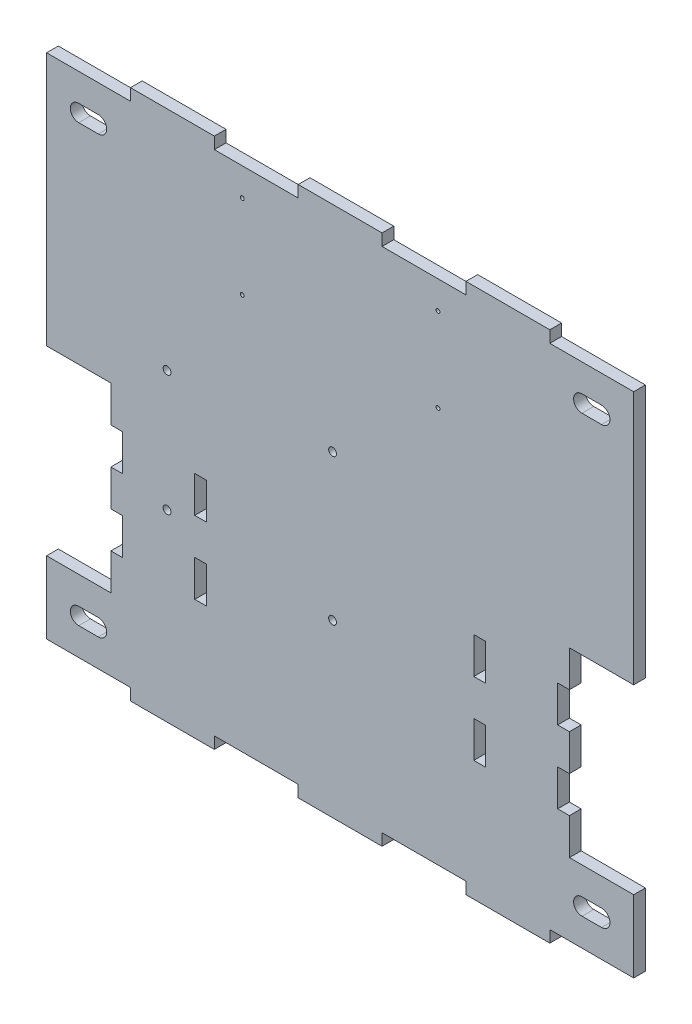
from build123d import *

# Parameters (mm, degrees)
SKETCH1_W           = 266.7
SKETCH1_H           = 241.3
BOSS_EXTRUDE1_DEPTH = 5.334
SKETCH2_W           = 29.21
SKETCH2_H           = 82.55
CUT_EXTRUDE1_DEPTH  = 180.908578328
SKETCH9_W           = 5.334
SKETCH9_H           = 16.51
CUT_EXTRUDE2_DEPTH  = 180.908578328
SKETCH23_W          = 5.334
SKETCH23_H          = 16.51
CUT_EXTRUDE8_DEPTH  = 180.908578328
SKETCH28_W          = 38.1
SKETCH28_H          = 5.334
CUT_EXTRUDE13_DEPTH = 180.908578328
SKETCH29_W          = 38.1
SKETCH29_H          = 5.334
CUT_EXTRUDE14_DEPTH = 180.908578328
SKETCH30_R          = 0.889
CUT_EXTRUDE15_DEPTH = 180.908578328
SKETCH32_R          = 1.778
CUT_EXTRUDE16_DEPTH = 180.908578328
CUT_EXTRUDE19_DEPTH = 180.908578328


with BuildPart() as part:
    # Sketch1 → Boss-Extrude1 (new body)
    with BuildSketch(Plane.XY):
        Rectangle(SKETCH1_W, SKETCH1_H)
    extrude(amount=BOSS_EXTRUDE1_DEPTH)

    # Sketch2 → Cut-Extrude1 (cut, through all)
    with BuildSketch(Plane(origin=(0, 0, 0), x_dir=(-1, 0, 0), z_dir=(0, 0, -1))):
        with Locations((118.745, -41.275)):
            Rectangle(SKETCH2_W, SKETCH2_H)
        with Locations((-118.745, -41.275)):
            Rectangle(SKETCH2_W, SKETCH2_H)
    extrude(amount=-CUT_EXTRUDE1_DEPTH, mode=Mode.SUBTRACT)

    # Sketch9 → Cut-Extrude2 (cut, through all)
    with BuildSketch(Plane.XY.offset(5.334)):
        with Locations((-101.473, -24.765)):
            Rectangle(SKETCH9_W, SKETCH9_H)
        with Locations((-101.473, -57.785)):
            Rectangle(SKETCH9_W, SKETCH9_H)
        with Locations((101.473, -57.785)):
            Rectangle(SKETCH9_W, SKETCH9_H)
        with Locations((101.473, -24.765)):
            Rectangle(SKETCH9_W, SKETCH9_H)
    extrude(amount=-CUT_EXTRUDE2_DEPTH, mode=Mode.SUBTRACT)

    # Sketch23 → Cut-Extrude8 (cut, through all)
    with BuildSketch(Plane.XY.offset(5.334)):
        with Locations((-63.373, -57.785)):
            Rectangle(SKETCH23_W, SKETCH23_H)
        with Locations((63.373, -24.765)):
            Rectangle(SKETCH23_W, SKETCH23_H)
        with Locations((63.373, -57.785)):
            Rectangle(SKETCH23_W, SKETCH23_H)
        with Locations((-63.373, -24.765)):
            Rectangle(SKETCH23_W, SKETCH23_H)
    extrude(amount=-CUT_EXTRUDE8_DEPTH, mode=Mode.SUBTRACT)

    # Sketch28 → Cut-Extrude13 (cut, through all)
    with BuildSketch(Plane(origin=(0, 0, 0), x_dir=(-1, 0, 0), z_dir=(0, 0, -1))):
        with Locations((-114.3, -117.983)):
            Rectangle(SKETCH28_W, SKETCH28_H)
        with Locations((-38.1, -117.983)):
            Rectangle(SKETCH28_W, SKETCH28_H)
        with Locations((38.1, -117.983)):
            Rectangle(SKETCH28_W, SKETCH28_H)
        with Locations((114.3, -117.983)):
            Rectangle(SKETCH28_W, SKETCH28_H)
    extrude(amount=-CUT_EXTRUDE13_DEPTH, mode=Mode.SUBTRACT)

    # Sketch29 → Cut-Extrude14 (cut, through all)
    with BuildSketch(Plane(origin=(0, 0, 0), x_dir=(-1, 0, 0), z_dir=(0, 0, -1))):
        with Locations((-114.3, 117.983)):
            Rectangle(SKETCH29_W, SKETCH29_H)
        with Locations((-38.1, 117.983)):
            Rectangle(SKETCH29_W, SKETCH29_H)
        with Locations((38.1, 117.983)):
            Rectangle(SKETCH29_W, SKETCH29_H)
        with Locations((114.3, 117.983)):
            Rectangle(SKETCH29_W, SKETCH29_H)
    extrude(amount=-CUT_EXTRUDE14_DEPTH, mode=Mode.SUBTRACT)

    # Sketch30 → Cut-Extrude15 (cut, through all)
    with BuildSketch(Plane.XY.offset(5.334)):
        with Locations((-44.45, 102.616)):
            Circle(SKETCH30_R)
        with Locations((44.45, 102.616)):
            Circle(SKETCH30_R)
        with Locations((-44.45, 64.516)):
            Circle(SKETCH30_R)
        with Locations((44.45, 64.516)):
            Circle(SKETCH30_R)
    extrude(amount=-CUT_EXTRUDE15_DEPTH, mode=Mode.SUBTRACT)

    # Sketch32 → Cut-Extrude16 (cut, through all)
    with BuildSketch(Plane(origin=(0, 0, 0), x_dir=(-1, 0, 0), z_dir=(0, 0, -1))):
        with Locations((3.430540545, -42.977508744)):
            Circle(SKETCH32_R)
        with Locations((78.614540545, -37.135508744)):
            Circle(SKETCH32_R)
        with Locations((3.430540545, 23.316491256)):
            Circle(SKETCH32_R)
        with Locations((78.614540545, 17.728491256)):
            Circle(SKETCH32_R)
    extrude(amount=-CUT_EXTRUDE16_DEPTH, mode=Mode.SUBTRACT)

    # Sketch35 → Cut-Extrude19 (cut, through all)
    with BuildSketch(Plane.XY.offset(5.334)):
        with BuildLine():
            Line((-109.855, -102.743), (-118.745, -102.743))
            ThreePointArc((-118.745, -102.743), (-122.555, -98.933), (-118.745, -95.123))
            Line((-118.745, -95.123), (-109.855, -95.123))
            ThreePointArc((-109.855, -95.123), (-106.045, -98.933), (-109.855, -102.743))
        make_face()
        with BuildLine():
            Line((109.855, -95.123), (118.745, -95.123))
            ThreePointArc((118.745, -95.123), (122.555, -98.933), (118.745, -102.743))
            Line((118.745, -102.743), (109.855, -102.743))
            ThreePointArc((109.855, -102.743), (106.045, -98.933), (109.855, -95.123))
        make_face()
        with BuildLine():
            Line((109.855, 95.123), (118.745, 95.123))
            ThreePointArc((118.745, 95.123), (122.555, 98.933), (118.745, 102.743))
            Line((118.745, 102.743), (109.855, 102.743))
            ThreePointArc((109.855, 102.743), (106.045, 98.933), (109.855, 95.123))
        make_face()
        with BuildLine():
            Line((-109.855, 102.743), (-118.745, 102.743))
            ThreePointArc((-118.745, 102.743), (-122.555, 98.933), (-118.745, 95.123))
            Line((-118.745, 95.123), (-109.855, 95.123))
            ThreePointArc((-109.855, 95.123), (-106.045, 98.933), (-109.855, 102.743))
        make_face()
    extrude(amount=-CUT_EXTRUDE19_DEPTH, mode=Mode.SUBTRACT)


solid = part.part
